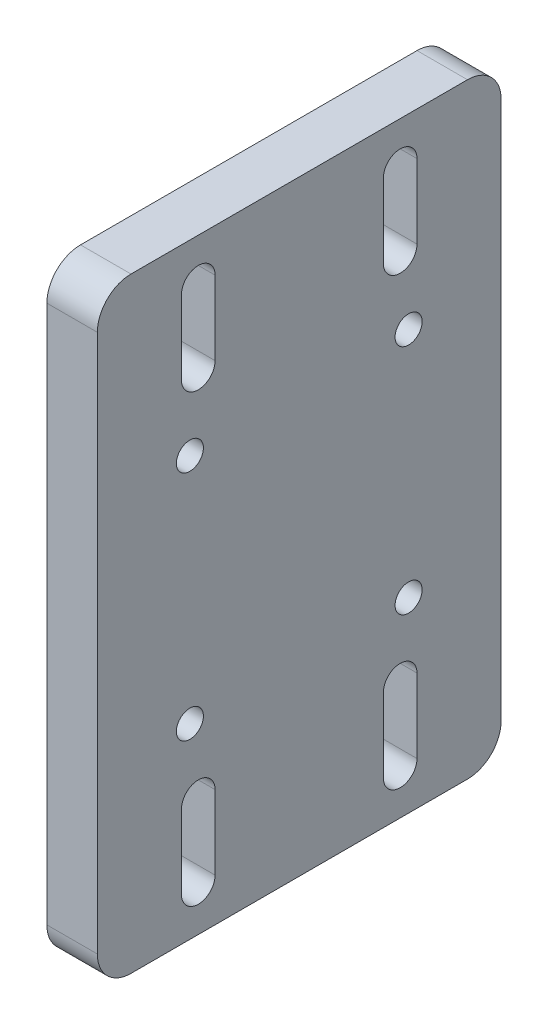
from build123d import *

# Parameters (mm, degrees)
SKETCH1_W               = 76.2
SKETCH1_H               = 114.3
BOSS_EXTRUDE1_DEPTH     = 9.525
F_1_4_20_TAPPED_HOLE1_D = 5.1054
CUT_EXTRUDE1_DEPTH      = 70.343046695
FILLET1_R               = 6.35


with BuildPart() as part:
    # Sketch1 → Boss-Extrude1 (new body)
    with BuildSketch(Plane(origin=(0, 0, 0), x_dir=(0, 0, -1), z_dir=(1, 0, 0))):
        Rectangle(SKETCH1_W, SKETCH1_H)
    extrude(amount=BOSS_EXTRUDE1_DEPTH)

    # 1/4-20 Tapped Hole1 (through all)
    with Locations(Plane(origin=(9.525, 0, 0), x_dir=(0, 0, -1), z_dir=(1, 0, 0))):
        with Locations((-20.6375, 21.9075), (20.6375, 21.9075), (20.6375, -21.9075), (-20.6375, -21.9075)):
            Hole(F_1_4_20_TAPPED_HOLE1_D / 2)

    # Sketch4 → Cut-Extrude1 (cut, through all)
    with BuildSketch(Plane(origin=(9.525, 0, 0), x_dir=(0, 0, -1), z_dir=(1, 0, 0))):
        with BuildLine():
            Line((15.875, 49.022), (15.875, 35.052))
            ThreePointArc((15.875, 35.052), (19.05, 31.877), (22.225, 35.052))
            Line((22.225, 35.052), (22.225, 49.022))
            ThreePointArc((22.225, 49.022), (19.05, 52.197), (15.875, 49.022))
        make_face()
        with BuildLine():
            Line((-22.225, 49.022), (-22.225, 35.052))
            ThreePointArc((-22.225, 35.052), (-19.05, 31.877), (-15.875, 35.052))
            Line((-15.875, 35.052), (-15.875, 49.022))
            ThreePointArc((-15.875, 49.022), (-19.05, 52.197), (-22.225, 49.022))
        make_face()
        with BuildLine():
            Line((-15.875, -49.022), (-15.875, -35.052))
            ThreePointArc((-15.875, -35.052), (-19.05, -31.877), (-22.225, -35.052))
            Line((-22.225, -35.052), (-22.225, -49.022))
            ThreePointArc((-22.225, -49.022), (-19.05, -52.197), (-15.875, -49.022))
        make_face()
        with BuildLine():
            Line((22.225, -49.022), (22.225, -35.052))
            ThreePointArc((22.225, -35.052), (19.05, -31.877), (15.875, -35.052))
            Line((15.875, -35.052), (15.875, -49.022))
            ThreePointArc((15.875, -49.022), (19.05, -52.197), (22.225, -49.022))
        make_face()
    extrude(amount=-CUT_EXTRUDE1_DEPTH, mode=Mode.SUBTRACT)

    # Fillet1
    fillet1_edges = [part.edges().sort_by_distance(p)[0] for p in [
        (4.7625, -57.15, 38.1),
        (4.7625, -57.15, -38.1),
        (4.7625, 57.15, -38.1),
        (4.7625, 57.15, 38.1),
    ]]
    fillet(fillet1_edges, radius=FILLET1_R)


solid = part.part
